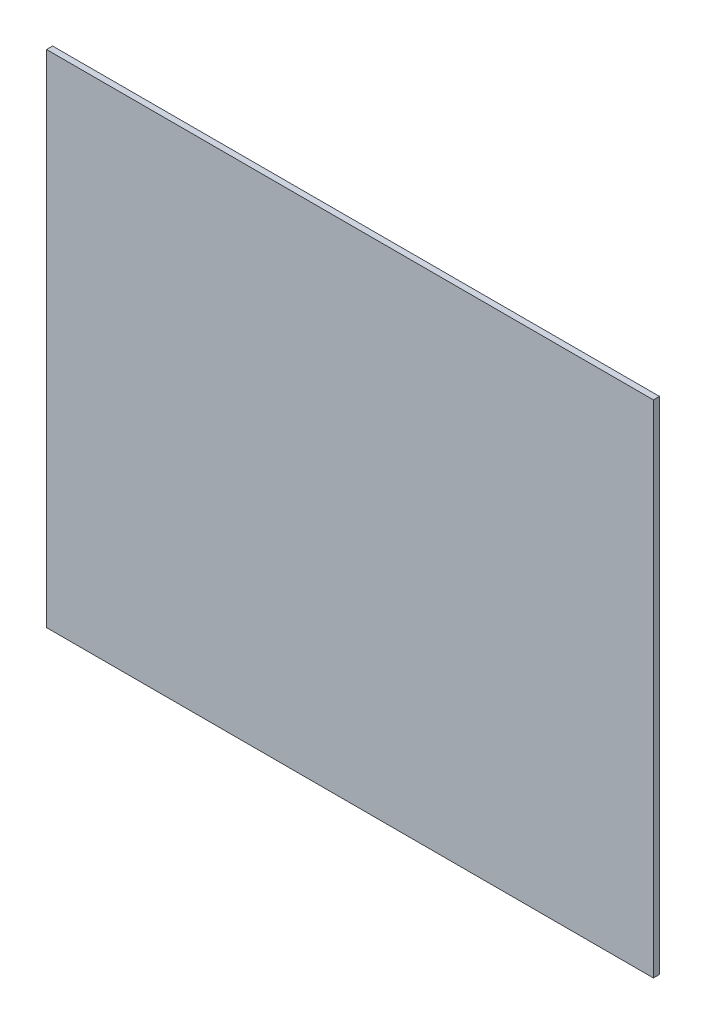
from build123d import *

# Parameters (mm, degrees)
CROQUIS1_W              = 400
CROQUIS1_H              = 330
SALIENTE_EXTRUIR1_DEPTH = 4


with BuildPart() as part:
    # Croquis1 → Saliente-Extruir1 (new body)
    with BuildSketch(Plane.XY):
        with Locations((200, 165)):
            Rectangle(CROQUIS1_W, CROQUIS1_H)
    extrude(amount=SALIENTE_EXTRUIR1_DEPTH)


solid = part.part
